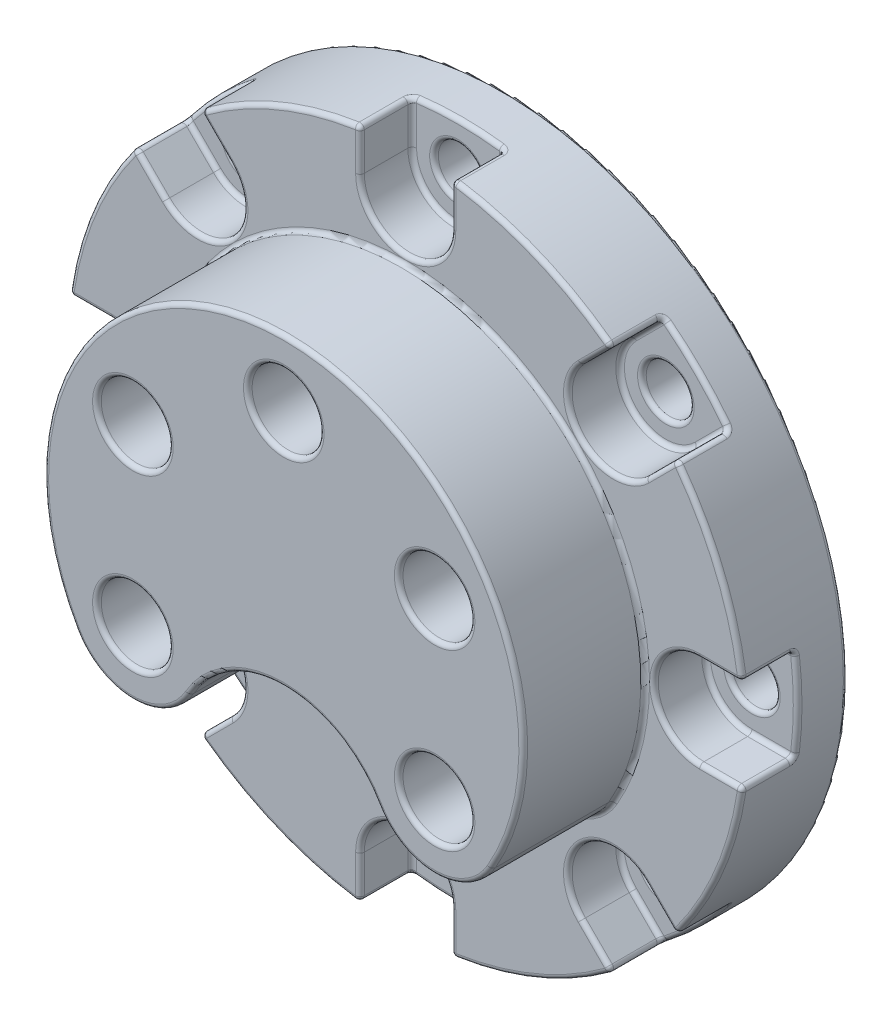
from build123d import *

# Parameters (mm, degrees)
SKETCH_1_R          = 15.6
SKETCH_1_R_2        = 1.1
EXTRUDE_1_DEPTH     = 4.7
CUT_EXTRUDE_START   = -2.4
CUT_EXTRUDE_1_DEPTH = 2.4
SKETCH_3_R          = 1.65
EXTRUDE_2_DEPTH     = 5.6
FILLET_1_R          = 0.2


with BuildPart() as part:
    # 스케치1 → 보스-돌출1 (new body)
    with BuildSketch(Plane.XY):
        with Locations(Location((0, 0, 0), (0, 0, 180))):
            Circle(SKETCH_1_R)
        with Locations(Location((-9.545941546, 9.545941546, 0), (0, 0, 180))):
            Circle(SKETCH_1_R_2, mode=Mode.SUBTRACT)
        with Locations(Location((-13.5, 0, 0), (0, 0, 180))):
            Circle(SKETCH_1_R_2, mode=Mode.SUBTRACT)
        with Locations(Location((-9.545941546, -9.545941546, 0), (0, 0, 180))):
            Circle(SKETCH_1_R_2, mode=Mode.SUBTRACT)
        with Locations(Location((0, -13.5, 0), (0, 0, 180))):
            Circle(SKETCH_1_R_2, mode=Mode.SUBTRACT)
        with Locations(Location((9.545941546, -9.545941546, 0), (0, 0, 180))):
            Circle(SKETCH_1_R_2, mode=Mode.SUBTRACT)
        with Locations(Location((13.5, 0, 0), (0, 0, 180))):
            Circle(SKETCH_1_R_2, mode=Mode.SUBTRACT)
        with Locations(Location((9.545941546, 9.545941546, 0), (0, 0, 180))):
            Circle(SKETCH_1_R_2, mode=Mode.SUBTRACT)
        with Locations(Location((0, 13.5, 0), (0, 0, 180))):
            Circle(SKETCH_1_R_2, mode=Mode.SUBTRACT)
    extrude(amount=EXTRUDE_1_DEPTH)

    # 스케치2 → 컷-돌출1 (cut)
    with BuildSketch(Plane.XY.offset(4.7).offset(CUT_EXTRUDE_START)):
        with BuildLine():
            Line((-2.1, 13.5), (-2.1, 15.458007634))
            ThreePointArc((-2.1, 15.458007634), (0, 15.6), (2.1, 15.458007634))
            Line((2.1, 15.458007634), (2.1, 13.5))
            ThreePointArc((2.1, 13.5), (0, 11.4), (-2.1, 13.5))
        make_face()
        with BuildLine():
            Line((11.030865787, 8.061017306), (12.415386262, 9.445537781))
            ThreePointArc((12.415386262, 9.445537781), (11.030865787, 11.030865787), (9.445537781, 12.415386262))
            Line((9.445537781, 12.415386262), (8.061017306, 11.030865787))
            ThreePointArc((8.061017306, 11.030865787), (8.061017306, 8.061017306), (11.030865787, 8.061017306))
        make_face()
        with BuildLine():
            Line((13.5, -2.1), (15.458007634, -2.1))
            ThreePointArc((15.458007634, -2.1), (15.6, 0), (15.458007634, 2.1))
            Line((15.458007634, 2.1), (13.5, 2.1))
            ThreePointArc((13.5, 2.1), (11.4, 0), (13.5, -2.1))
        make_face()
        with BuildLine():
            Line((8.061017306, -11.030865787), (9.445537781, -12.415386262))
            ThreePointArc((9.445537781, -12.415386262), (11.030865787, -11.030865787), (12.415386262, -9.445537781))
            Line((12.415386262, -9.445537781), (11.030865787, -8.061017306))
            ThreePointArc((11.030865787, -8.061017306), (8.061017306, -8.061017306), (8.061017306, -11.030865787))
        make_face()
        with BuildLine():
            Line((-2.1, -13.5), (-2.1, -15.458007634))
            ThreePointArc((-2.1, -15.458007634), (0, -15.6), (2.1, -15.458007634))
            Line((2.1, -15.458007634), (2.1, -13.5))
            ThreePointArc((2.1, -13.5), (0, -11.4), (-2.1, -13.5))
        make_face()
        with BuildLine():
            Line((-11.030865787, -8.061017306), (-12.415386262, -9.445537781))
            ThreePointArc((-12.415386262, -9.445537781), (-11.030865787, -11.030865787), (-9.445537781, -12.415386262))
            Line((-9.445537781, -12.415386262), (-8.061017306, -11.030865787))
            ThreePointArc((-8.061017306, -11.030865787), (-8.061017306, -8.061017306), (-11.030865787, -8.061017306))
        make_face()
        with BuildLine():
            Line((-13.5, 2.1), (-15.458007634, 2.1))
            ThreePointArc((-15.458007634, 2.1), (-15.6, 0), (-15.458007634, -2.1))
            Line((-15.458007634, -2.1), (-13.5, -2.1))
            ThreePointArc((-13.5, -2.1), (-11.4, 0), (-13.5, 2.1))
        make_face()
        with BuildLine():
            Line((-8.061017306, 11.030865787), (-9.445537781, 12.415386262))
            ThreePointArc((-9.445537781, 12.415386262), (-11.030865787, 11.030865787), (-12.415386262, 9.445537781))
            Line((-12.415386262, 9.445537781), (-11.030865787, 8.061017306))
            ThreePointArc((-11.030865787, 8.061017306), (-8.061017306, 8.061017306), (-8.061017306, 11.030865787))
        make_face()
    extrude(amount=CUT_EXTRUDE_1_DEPTH, mode=Mode.SUBTRACT)

    # 스케치3 → 보스-돌출2 (add)
    with BuildSketch(Plane.XY.offset(4.7)):
        with BuildLine():
            ThreePointArc((4.330127019, -5.5), (0, -3), (-4.330127019, -5.5))
            ThreePointArc((-4.330127019, -5.5), (-6.92820323, -7), (-9.526279442, -5.5))
            ThreePointArc((-9.526279442, -5.5), (0, 11), (9.526279442, -5.5))
            ThreePointArc((9.526279442, -5.5), (6.92820323, -7), (4.330127019, -5.5))
        make_face()
        with Locations((-6.92820323, 4)):
            Circle(SKETCH_3_R, mode=Mode.SUBTRACT)
        with Locations((-6.92820323, -4)):
            Circle(SKETCH_3_R, mode=Mode.SUBTRACT)
        with Locations((6.92820323, -4)):
            Circle(SKETCH_3_R, mode=Mode.SUBTRACT)
        with Locations((6.92820323, 4)):
            Circle(SKETCH_3_R, mode=Mode.SUBTRACT)
        with Locations((0, 8)):
            Circle(SKETCH_3_R, mode=Mode.SUBTRACT)
    extrude(amount=EXTRUDE_2_DEPTH)

    # 필렛1
    fillet_1_edges = [part.edges().sort_by_distance(p)[0] for p in [
        (8.061017306, 8.061017306, 2.3),
        (8.753277543, 11.723126024, 2.3),
        (11.030865787, 11.030865787, 2.3),
        (9.445537781, 12.415386262, 3.5),
        (11.723126024, 8.753277543, 2.3),
        (12.415386262, 9.445537781, 3.5),
        (10.645941546, 9.545941546, 2.3),
        (8.061017306, 8.061017306, 4.7),
        (11.723126024, 8.753277543, 4.7),
        (8.753277543, 11.723126024, 4.7),
        (0, 11.4, 2.3),
        (-2.1, 14.479003817, 2.3),
        (0, 15.6, 2.3),
        (-2.1, 15.458007634, 3.5),
        (2.1, 14.479003817, 2.3),
        (2.1, 15.458007634, 3.5),
        (1.1, 13.5, 2.3),
        (0, 11.4, 4.7),
        (2.1, 14.479003817, 4.7),
        (-2.1, 14.479003817, 4.7),
        (15.6, 0, 0),
        (1.1, 13.5, 0),
        (10.645941546, 9.545941546, 0),
        (14.6, 0, 0),
        (10.645941546, -9.545941546, 0),
        (1.1, -13.5, 0),
        (-8.445941546, -9.545941546, 0),
        (-12.4, 0, 0),
        (-8.445941546, 9.545941546, 0),
        (0, -3, 10.3),
        (6.92820323, -7, 4.7),
        (0, 11, 4.7),
        (5.27820323, 4, 10.3),
        (5.27820323, -4, 10.3),
        (-8.57820323, -4, 10.3),
        (-8.57820323, 4, 10.3),
        (-6.92820323, -7, 4.7),
        (-1.65, 8, 10.3),
        (6.92820323, -7, 10.3),
        (0, 11, 10.3),
        (-6.92820323, -7, 10.3),
        (0, -3, 4.7),
        (5.969861545, 14.412520707, 4.7),
        (-5.969861545, 14.412520707, 4.7),
        (-14.412520707, 5.969861545, 4.7),
        (-14.412520707, -5.969861545, 4.7),
        (-5.969861545, -14.412520707, 4.7),
        (5.969861545, -14.412520707, 4.7),
        (14.412520707, -5.969861545, 4.7),
        (14.412520707, 5.969861545, 4.7),
        (-8.061017306, 8.061017306, 2.3),
        (-11.723126024, 8.753277543, 2.3),
        (-11.030865787, 11.030865787, 2.3),
        (-12.415386262, 9.445537781, 3.5),
        (-8.753277543, 11.723126024, 2.3),
        (-9.445537781, 12.415386262, 3.5),
        (-8.445941546, 9.545941546, 2.3),
        (-8.061017306, 8.061017306, 4.7),
        (-8.753277543, 11.723126024, 4.7),
        (-11.723126024, 8.753277543, 4.7),
        (-11.4, 0, 2.3),
        (-14.479003817, -2.1, 2.3),
        (-15.564461428, -1.052397481, 2.3),
        (-15.458007634, -2.1, 3.5),
        (-14.479003817, 2.1, 2.3),
        (-15.458007634, 2.1, 3.5),
        (-12.4, 0, 2.3),
        (-11.4, 0, 4.7),
        (-14.479003817, 2.1, 4.7),
        (-14.479003817, -2.1, 4.7),
        (-8.061017306, -8.061017306, 2.3),
        (-8.753277543, -11.723126024, 2.3),
        (-11.030865787, -11.030865787, 2.3),
        (-9.445537781, -12.415386262, 3.5),
        (-11.723126024, -8.753277543, 2.3),
        (-12.415386262, -9.445537781, 3.5),
        (-8.445941546, -9.545941546, 2.3),
        (-8.061017306, -8.061017306, 4.7),
        (-11.723126024, -8.753277543, 4.7),
        (-8.753277543, -11.723126024, 4.7),
        (0, -11.4, 2.3),
        (2.1, -14.479003817, 2.3),
        (0, -15.6, 2.3),
        (2.1, -15.458007634, 3.5),
        (-2.1, -14.479003817, 2.3),
        (-2.1, -15.458007634, 3.5),
        (1.1, -13.5, 2.3),
        (0, -11.4, 4.7),
        (-2.1, -14.479003817, 4.7),
        (2.1, -14.479003817, 4.7),
        (8.061017306, -8.061017306, 2.3),
        (11.723126024, -8.753277543, 2.3),
        (11.030865787, -11.030865787, 2.3),
        (12.415386262, -9.445537781, 3.5),
        (8.753277543, -11.723126024, 2.3),
        (9.445537781, -12.415386262, 3.5),
        (10.645941546, -9.545941546, 2.3),
        (8.061017306, -8.061017306, 4.7),
        (8.753277543, -11.723126024, 4.7),
        (11.723126024, -8.753277543, 4.7),
        (11.4, 0, 2.3),
        (14.479003817, 2.1, 2.3),
        (15.6, 0, 2.3),
        (15.458007634, 2.1, 3.5),
        (14.479003817, -2.1, 2.3),
        (15.458007634, -2.1, 3.5),
        (14.6, 0, 2.3),
        (11.4, 0, 4.7),
        (14.479003817, -2.1, 4.7),
        (14.479003817, 2.1, 4.7),
    ]]
    fillet(fillet_1_edges, radius=FILLET_1_R - 0.0001)  # a hair under: the kernel refuses the full size


solid = part.part
